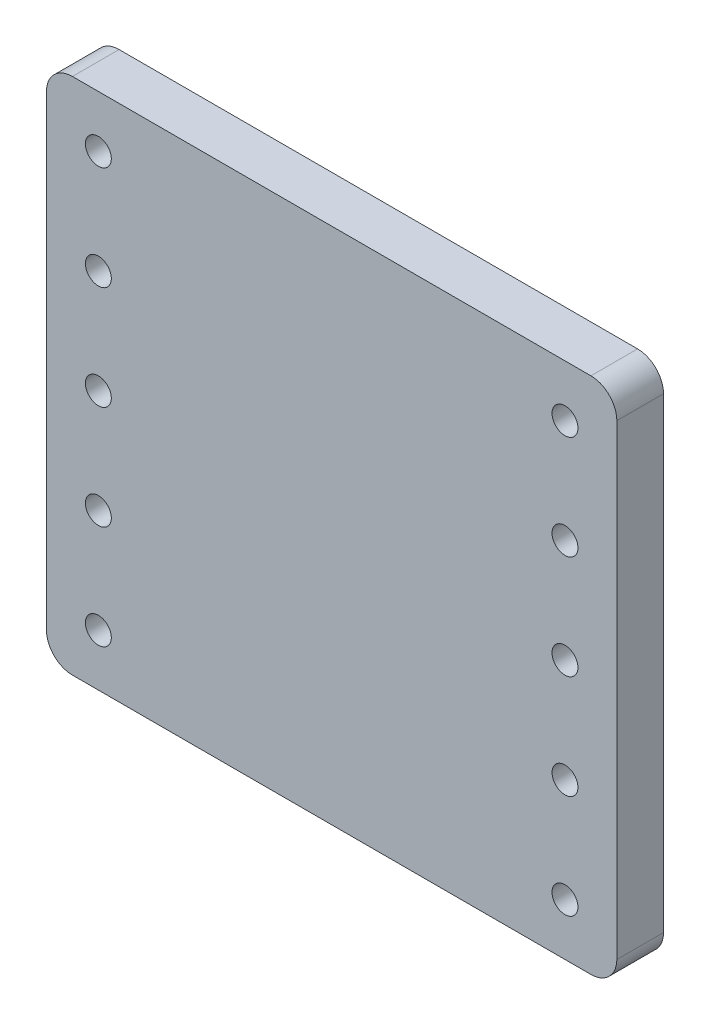
from build123d import *

# Parameters (mm, degrees)
SKETCH_1_R      = 5
EXTRUDE_1_DEPTH = 5
SKETCH_3_W      = 200
SKETCH_3_H      = 180
EXTRUDE_2_DEPTH = 8


with BuildPart() as part:
    # 草图1 → 凸台-拉伸1 (new, symmetric)
    with BuildSketch(Plane.XY):
        with BuildLine():
            Line((-100, -100), (100, -100))
            ThreePointArc((100, -100), (107.071067812, -97.071067812), (110, -90))
            Line((110, -90), (110, 90))
            ThreePointArc((110, 90), (107.071067812, 97.071067812), (100, 100))
            Line((100, 100), (-100, 100))
            ThreePointArc((-100, 100), (-107.071067812, 97.071067812), (-110, 90))
            Line((-110, 90), (-110, -90))
            ThreePointArc((-110, -90), (-107.071067812, -97.071067812), (-100, -100))
        make_face()
        with Locations((-90, 0)):
            Circle(SKETCH_1_R, mode=Mode.SUBTRACT)
        with Locations((90, 0)):
            Circle(SKETCH_1_R, mode=Mode.SUBTRACT)
        with Locations((-90, 40)):
            Circle(SKETCH_1_R, mode=Mode.SUBTRACT)
        with Locations((-90, -40)):
            Circle(SKETCH_1_R, mode=Mode.SUBTRACT)
        with Locations((90, -40)):
            Circle(SKETCH_1_R, mode=Mode.SUBTRACT)
        with Locations((90, 40)):
            Circle(SKETCH_1_R, mode=Mode.SUBTRACT)
        with Locations((-90, -80)):
            Circle(SKETCH_1_R, mode=Mode.SUBTRACT)
        with Locations((-90, 80)):
            Circle(SKETCH_1_R, mode=Mode.SUBTRACT)
        with Locations((90, -80)):
            Circle(SKETCH_1_R, mode=Mode.SUBTRACT)
        with Locations((90, 80)):
            Circle(SKETCH_1_R, mode=Mode.SUBTRACT)
    extrude(amount=EXTRUDE_1_DEPTH, both=True)

    # 草图3 → 凸台-拉伸2 (add)
    with BuildSketch(Plane(origin=(0, 0, -5), x_dir=(-1, 0, 0), z_dir=(0, 0, -1))):
        with BuildLine():
            Line((110, 90), (110, -90))
            ThreePointArc((110, -90), (107.071067812, -97.071067812), (100, -100))
            Line((100, -100), (-100, -100))
            ThreePointArc((-100, -100), (-107.071067812, -97.071067812), (-110, -90))
            Line((-110, -90), (-110, 90))
            ThreePointArc((-110, 90), (-107.071067812, 97.071067812), (-100, 100))
            Line((-100, 100), (100, 100))
            ThreePointArc((100, 100), (107.071067812, 97.071067812), (110, 90))
        make_face()
        Rectangle(SKETCH_3_W, SKETCH_3_H, mode=Mode.SUBTRACT)
    extrude(amount=EXTRUDE_2_DEPTH)


solid = part.part
